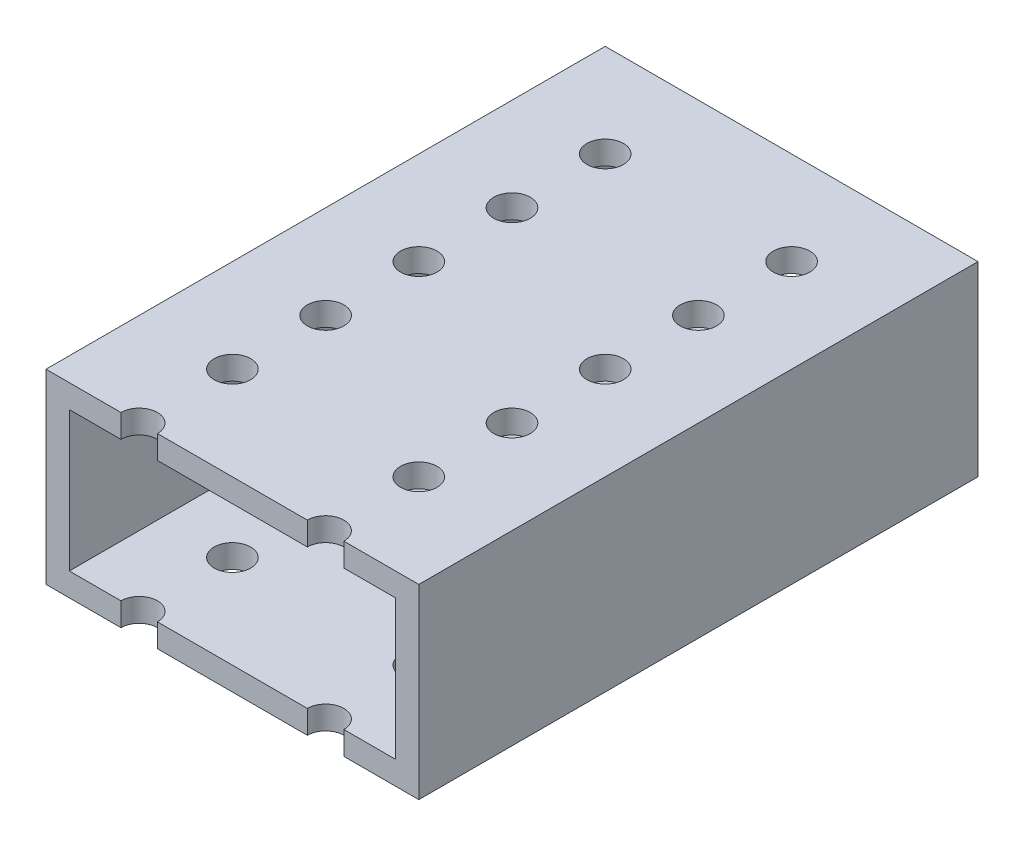
from build123d import *

# Parameters (mm, degrees)
SKETCH1_W           = 50.8
SKETCH1_H           = 25.4
BOSS_EXTRUDE1_DEPTH = 38.1
SHELL1_T            = -3.175
SKETCH2_R           = 2.4892
CUT_EXTRUDE1_DEPTH  = 63.5


with BuildPart() as part:
    # Sketch1 → Boss-Extrude1 (new, symmetric)
    with BuildSketch(Plane.XY):
        Rectangle(SKETCH1_W, SKETCH1_H)
    extrude(amount=BOSS_EXTRUDE1_DEPTH, both=True)

    # Shell1
    shell1_openings = [part.faces().sort_by_distance(p)[0] for p in [
        (0, 0, -38.1),
        (0, 0, 38.1),
    ]]
    offset(amount=SHELL1_T, openings=shell1_openings, kind=Kind.INTERSECTION)

    # Sketch2 → Cut-Extrude1 (cut, symmetric)
    with BuildSketch(Plane(origin=(0, 0, 0), x_dir=(1, 0, 0), z_dir=(0, 1, 0))):
        with Locations((-12.7, 25.4)):
            Circle(SKETCH2_R)
        with Locations((12.7, 25.4)):
            Circle(SKETCH2_R)
        with Locations((12.7, 12.7)):
            Circle(SKETCH2_R)
        with Locations((12.7, 0)):
            Circle(SKETCH2_R)
        with Locations((12.7, -12.7)):
            Circle(SKETCH2_R)
        with Locations((12.7, -25.4)):
            Circle(SKETCH2_R)
        with Locations((12.7, -38.1)):
            Circle(SKETCH2_R)
        with Locations((-12.7, 12.7)):
            Circle(SKETCH2_R)
        with Locations((-12.7, 0)):
            Circle(SKETCH2_R)
        with Locations((-12.7, -12.7)):
            Circle(SKETCH2_R)
        with Locations((-12.7, -25.4)):
            Circle(SKETCH2_R)
        with Locations((-12.7, -38.1)):
            Circle(SKETCH2_R)
    extrude(amount=CUT_EXTRUDE1_DEPTH, both=True, mode=Mode.SUBTRACT)


solid = part.part
